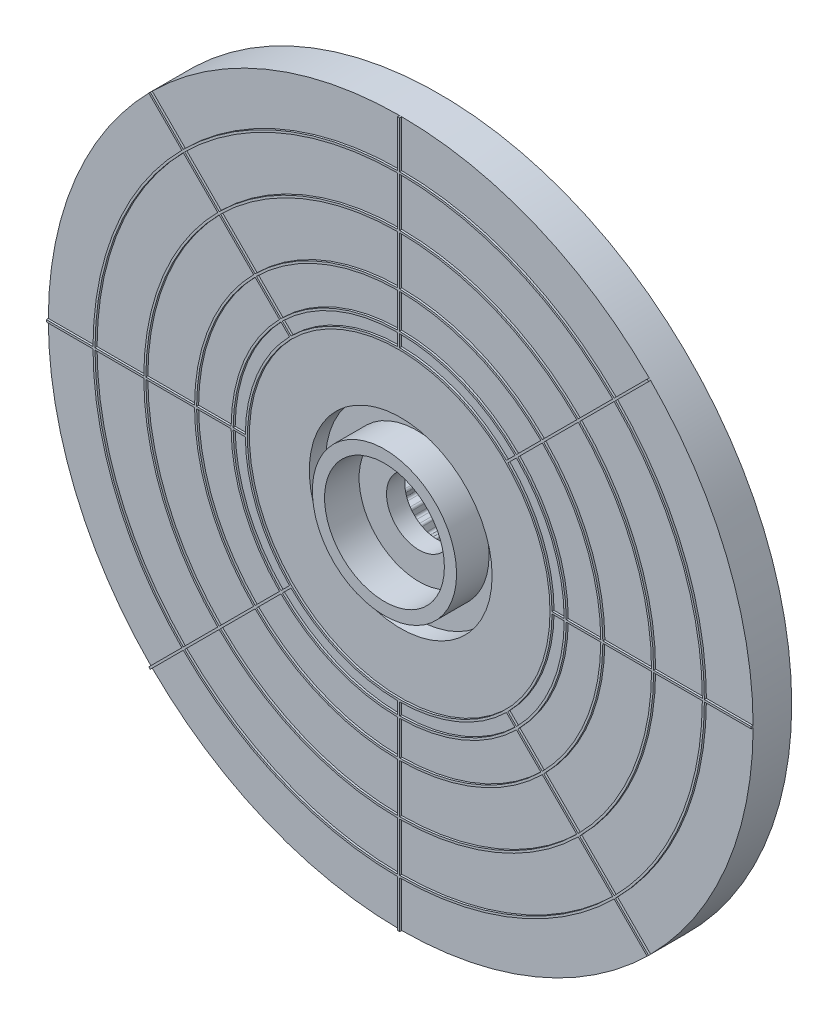
from build123d import *

# Parameters (mm, degrees)
AUFSATZ_LINEAR_START            = 3.1
AUFSATZ_LINEAR_AUSTRAGEN4_DEPTH = 3.1
KREISMUSTER1_COUNT              = 25
SKIZZE6_OUTSIDE_W               = 53.37
SKIZZE6_OUTSIDE_H               = 53.37
SKIZZE6_OUTSIDE_R               = 17.35
RUND1_DEPTH                     = 29.705574372
RUND2_OUTLINE_R                 = 7.45
RUND2_DEPTH                     = 0.1


# Read off the part's stored shape, not the designer's step: Rund2
with BuildPart() as part:
    # Skizze5 → Rotation2 (revolve)
    with BuildSketch(Plane(origin=(0, 0, 0), x_dir=(0, 0, -1), z_dir=(1, 0, 0)), mode=Mode.PRIVATE) as rotation2_sk:
        Polygon((0.75, 4.1), (3.1, 4.1), (3.1, 2.9), (0, 2.9), (0, 1.6), (-0.9, 1.6), (-0.9, 2.95), (-2.6, 2.95), (-2.6, 3.55), (-1, 3.55), (-1, 4.5), (-1.8, 4.5), (-1.8, 20), (0.1, 20), (0.1, 4.75), align=None)
    revolve(rotation2_sk.sketch.rotate(Axis((0, 0, 0), (0, 0, -1)), 90), axis=Axis((0, 0, 0), (0, 0, -1)))

    # Skizze4 → Aufsatz-Linear austragen4 (add)
    with BuildSketch(Plane.XY.offset(-3.1).offset(AUFSATZ_LINEAR_START)):
        with BuildLine():
            Line((-0.278608295, 2.846980046), (-0.072324759, 2.630941117))
            ThreePointArc((-0.072324759, 2.630941117), (0, 2.6), (0.072324759, 2.630941117))
            Line((0.072324759, 2.630941117), (0.278608295, 2.846980046))
            ThreePointArc((0.278608295, 2.846980046), (0.317450991, 2.872149352), (0.363466377, 2.877132634))
            ThreePointArc((0.363466377, 2.877132634), (0, 2.9), (-0.363466377, 2.877132634))
            ThreePointArc((-0.363466377, 2.877132634), (-0.317450991, 2.872149352), (-0.278608295, 2.846980046))
        make_face()
    aufsatz_linear_austragen4 = extrude(amount=-AUFSATZ_LINEAR_AUSTRAGEN4_DEPTH)

    # Kreismuster1: Aufsatz-Linear austragen4 ×25 about axis
    kreismuster1_axis = Axis((0, 0, 0), (0, 0, 1))
    for i in range(1, KREISMUSTER1_COUNT):
        add(aufsatz_linear_austragen4.rotate(kreismuster1_axis, i * 360 / KREISMUSTER1_COUNT))

    # Skizze6 outside → Rund1 (cut, through all)
    with BuildSketch(Plane.XY.offset(1.8)):
        Rectangle(SKIZZE6_OUTSIDE_W, SKIZZE6_OUTSIDE_H)
        Circle(SKIZZE6_OUTSIDE_R, mode=Mode.SUBTRACT)
    extrude(amount=-RUND1_DEPTH, mode=Mode.SUBTRACT)

    # Rund2 outline → Rund2 (add)
    with BuildSketch(Plane.XY.offset(1.8)):
        with BuildLine():
            Line((-0.05, 17.35), (-0.05, 15.049916943))
            ThreePointArc((-0.05, 15.049916943), (-5.759385657, 13.904386964), (-10.606542988, 10.677253666))
            Line((-10.606542988, 10.677253666), (-12.232947315, 12.303657993))
            Line((-12.232947315, 12.303657993), (-12.303657993, 12.232947315))
            Line((-12.303657993, 12.232947315), (-10.677253666, 10.606542988))
            ThreePointArc((-10.677253666, 10.606542988), (-13.904386964, 5.759385657), (-15.049916943, 0.05))
            Line((-15.049916943, 0.05), (-17.35, 0.05))
            Line((-17.35, 0.05), (-17.35, -0.05))
            Line((-17.35, -0.05), (-15.049916943, -0.05))
            ThreePointArc((-15.049916943, -0.05), (-13.904386964, -5.759385657), (-10.677253666, -10.606542988))
            Line((-10.677253666, -10.606542988), (-12.303657993, -12.232947315))
            Line((-12.303657993, -12.232947315), (-12.232947315, -12.303657993))
            Line((-12.232947315, -12.303657993), (-10.606542988, -10.677253666))
            ThreePointArc((-10.606542988, -10.677253666), (-5.759385657, -13.904386964), (-0.05, -15.049916943))
            Line((-0.05, -15.049916943), (-0.05, -17.35))
            Line((-0.05, -17.35), (0.05, -17.35))
            Line((0.05, -17.35), (0.05, -15.049916943))
            ThreePointArc((0.05, -15.049916943), (5.759385657, -13.904386964), (10.606542988, -10.677253666))
            Line((10.606542988, -10.677253666), (12.232947315, -12.303657993))
            Line((12.232947315, -12.303657993), (12.303657993, -12.232947315))
            Line((12.303657993, -12.232947315), (10.677253666, -10.606542988))
            ThreePointArc((10.677253666, -10.606542988), (13.904386964, -5.759385657), (15.049916943, -0.05))
            Line((15.049916943, -0.05), (17.35, -0.05))
            Line((17.35, -0.05), (17.35, 0.05))
            Line((17.35, 0.05), (15.049916943, 0.05))
            ThreePointArc((15.049916943, 0.05), (13.904386964, 5.759385657), (10.677253666, 10.606542988))
            Line((10.677253666, 10.606542988), (12.303657993, 12.232947315))
            Line((12.303657993, 12.232947315), (12.232947315, 12.303657993))
            Line((12.232947315, 12.303657993), (10.606542988, 10.677253666))
            ThreePointArc((10.606542988, 10.677253666), (5.759385657, 13.904386964), (0.05, 15.049916943))
            Line((0.05, 15.049916943), (0.05, 17.35))
            Line((0.05, 17.35), (-0.05, 17.35))
        make_face()
        with BuildLine():
            Line((-0.05, -12.549900398), (-0.05, -14.949916388))
            ThreePointArc((-0.05, -14.949916388), (-5.721117314, -13.811999011), (-10.535831917, -10.606542595))
            Line((-10.535831917, -10.606542595), (-8.838764336, -8.909475014))
            ThreePointArc((-8.838764336, -8.909475014), (-4.802677076, -11.594688133), (-0.05, -12.549900398))
        make_face(mode=Mode.SUBTRACT)
        with BuildLine():
            Line((-0.05, -10.049875621), (-0.05, -12.449899598))
            ThreePointArc((-0.05, -12.449899598), (-4.764408733, -11.50230018), (-8.768053092, -8.83876377))
            Line((-8.768053092, -8.83876377), (-7.070979863, -7.141690541))
            ThreePointArc((-7.070979863, -7.141690541), (-3.845968495, -9.284989302), (-0.05, -10.049875621))
        make_face(mode=Mode.SUBTRACT)
        with BuildLine():
            ThreePointArc((-12.549900398, -0.05), (-11.594688133, -4.802677076), (-8.909475014, -8.838764336))
            Line((-8.909475014, -8.838764336), (-10.606542595, -10.535831917))
            ThreePointArc((-10.606542595, -10.535831917), (-13.811999011, -5.721117314), (-14.949916388, -0.05))
            Line((-14.949916388, -0.05), (-12.549900398, -0.05))
        make_face(mode=Mode.SUBTRACT)
        with BuildLine():
            ThreePointArc((-10.049875621, -0.05), (-9.284989302, -3.845968495), (-7.141690541, -7.070979863))
            Line((-7.141690541, -7.070979863), (-8.83876377, -8.768053092))
            ThreePointArc((-8.83876377, -8.768053092), (-11.50230018, -4.764408733), (-12.449899598, -0.05))
            Line((-12.449899598, -0.05), (-10.049875621, -0.05))
        make_face(mode=Mode.SUBTRACT)
        with BuildLine():
            Line((-0.05, -8.249848483), (-0.05, -9.949874371))
            ThreePointArc((-0.05, -9.949874371), (-3.807700152, -9.192601348), (-7.000268301, -7.070978979))
            Line((-7.000268301, -7.070978979), (-5.798168467, -5.868879145))
            ThreePointArc((-5.798168467, -5.868879145), (-3.157138317, -7.622006143), (-0.05, -8.249848483))
        make_face(mode=Mode.SUBTRACT)
        with BuildLine():
            Line((-0.05, -7.549834435), (-0.05, -8.149846624))
            ThreePointArc((-0.05, -8.149846624), (-3.118869974, -7.52961819), (-5.727456475, -5.798167153))
            Line((-5.727456475, -5.798167153), (-5.303183787, -5.373894465))
            ThreePointArc((-5.303183787, -5.373894465), (-2.889259914, -6.97529047), (-0.05, -7.549834435))
        make_face(mode=Mode.SUBTRACT)
        with BuildLine():
            Line((-5.868879145, -5.798168467), (-7.070978979, -7.000268301))
            ThreePointArc((-7.070978979, -7.000268301), (-9.192601348, -3.807700152), (-9.949874371, -0.05))
            Line((-9.949874371, -0.05), (-8.249848483, -0.05))
            ThreePointArc((-8.249848483, -0.05), (-7.622006143, -3.157138317), (-5.868879145, -5.798168467))
        make_face(mode=Mode.SUBTRACT)
        with BuildLine():
            Line((-5.373894465, -5.303183787), (-5.798167153, -5.727456475))
            ThreePointArc((-5.798167153, -5.727456475), (-7.52961819, -3.118869974), (-8.149846624, -0.05))
            Line((-8.149846624, -0.05), (-7.549834435, -0.05))
            ThreePointArc((-7.549834435, -0.05), (-6.97529047, -2.889259914), (-5.373894465, -5.303183787))
        make_face(mode=Mode.SUBTRACT)
        with BuildLine():
            ThreePointArc((10.535831917, -10.606542595), (5.721117314, -13.811999011), (0.05, -14.949916388))
            Line((0.05, -14.949916388), (0.05, -12.549900398))
            ThreePointArc((0.05, -12.549900398), (4.802677076, -11.594688133), (8.838764336, -8.909475014))
            Line((8.838764336, -8.909475014), (10.535831917, -10.606542595))
        make_face(mode=Mode.SUBTRACT)
        with BuildLine():
            ThreePointArc((8.768053092, -8.83876377), (4.764408733, -11.50230018), (0.05, -12.449899598))
            Line((0.05, -12.449899598), (0.05, -10.049875621))
            ThreePointArc((0.05, -10.049875621), (3.845968495, -9.284989302), (7.070979863, -7.141690541))
            Line((7.070979863, -7.141690541), (8.768053092, -8.83876377))
        make_face(mode=Mode.SUBTRACT)
        with BuildLine():
            ThreePointArc((7.000268301, -7.070978979), (3.807700152, -9.192601348), (0.05, -9.949874371))
            Line((0.05, -9.949874371), (0.05, -8.249848483))
            ThreePointArc((0.05, -8.249848483), (3.157138317, -7.622006143), (5.798168467, -5.868879145))
            Line((5.798168467, -5.868879145), (7.000268301, -7.070978979))
        make_face(mode=Mode.SUBTRACT)
        with BuildLine():
            ThreePointArc((5.727456475, -5.798167153), (3.118869974, -7.52961819), (0.05, -8.149846624))
            Line((0.05, -8.149846624), (0.05, -7.549834435))
            ThreePointArc((0.05, -7.549834435), (2.889259914, -6.97529047), (5.303183787, -5.373894465))
            Line((5.303183787, -5.373894465), (5.727456475, -5.798167153))
        make_face(mode=Mode.SUBTRACT)
        with BuildLine():
            Line((8.249848483, -0.05), (9.949874371, -0.05))
            ThreePointArc((9.949874371, -0.05), (9.192601348, -3.807700152), (7.070978979, -7.000268301))
            Line((7.070978979, -7.000268301), (5.868879145, -5.798168467))
            ThreePointArc((5.868879145, -5.798168467), (7.622006143, -3.157138317), (8.249848483, -0.05))
        make_face(mode=Mode.SUBTRACT)
        with BuildLine():
            ThreePointArc((8.149846624, -0.05), (7.52961819, -3.118869974), (5.798167153, -5.727456475))
            Line((5.798167153, -5.727456475), (5.373894465, -5.303183787))
            ThreePointArc((5.373894465, -5.303183787), (6.97529047, -2.889259914), (7.549834435, -0.05))
            Line((7.549834435, -0.05), (8.149846624, -0.05))
        make_face(mode=Mode.SUBTRACT)
        with BuildLine():
            ThreePointArc((7.141690541, -7.070979863), (9.284989302, -3.845968495), (10.049875621, -0.05))
            Line((10.049875621, -0.05), (12.449899598, -0.05))
            ThreePointArc((12.449899598, -0.05), (11.50230018, -4.764408733), (8.83876377, -8.768053092))
            Line((8.83876377, -8.768053092), (7.141690541, -7.070979863))
        make_face(mode=Mode.SUBTRACT)
        with BuildLine():
            ThreePointArc((8.909475014, -8.838764336), (11.594688133, -4.802677076), (12.549900398, -0.05))
            Line((12.549900398, -0.05), (14.949916388, -0.05))
            ThreePointArc((14.949916388, -0.05), (13.811999011, -5.721117314), (10.606542595, -10.535831917))
            Line((10.606542595, -10.535831917), (8.909475014, -8.838764336))
        make_face(mode=Mode.SUBTRACT)
        with BuildLine():
            ThreePointArc((-8.909475014, 8.838764336), (-11.594688133, 4.802677076), (-12.549900398, 0.05))
            Line((-12.549900398, 0.05), (-14.949916388, 0.05))
            ThreePointArc((-14.949916388, 0.05), (-13.811999011, 5.721117314), (-10.606542595, 10.535831917))
            Line((-10.606542595, 10.535831917), (-8.909475014, 8.838764336))
        make_face(mode=Mode.SUBTRACT)
        with BuildLine():
            ThreePointArc((-7.141690541, 7.070979863), (-9.284989302, 3.845968495), (-10.049875621, 0.05))
            Line((-10.049875621, 0.05), (-12.449899598, 0.05))
            ThreePointArc((-12.449899598, 0.05), (-11.50230018, 4.764408733), (-8.83876377, 8.768053092))
            Line((-8.83876377, 8.768053092), (-7.141690541, 7.070979863))
        make_face(mode=Mode.SUBTRACT)
        with BuildLine():
            ThreePointArc((-8.149846624, 0.05), (-7.52961819, 3.118869974), (-5.798167153, 5.727456475))
            Line((-5.798167153, 5.727456475), (-5.373894465, 5.303183787))
            ThreePointArc((-5.373894465, 5.303183787), (-6.97529047, 2.889259914), (-7.549834435, 0.05))
            Line((-7.549834435, 0.05), (-8.149846624, 0.05))
        make_face(mode=Mode.SUBTRACT)
        with BuildLine():
            ThreePointArc((-9.949874371, 0.05), (-9.192601348, 3.807700152), (-7.070978979, 7.000268301))
            Line((-7.070978979, 7.000268301), (-5.868879145, 5.798168467))
            ThreePointArc((-5.868879145, 5.798168467), (-7.622006143, 3.157138317), (-8.249848483, 0.05))
            Line((-8.249848483, 0.05), (-9.949874371, 0.05))
        make_face(mode=Mode.SUBTRACT)
        with BuildLine():
            Line((-0.05, 8.149846624), (-0.05, 7.549834435))
            ThreePointArc((-0.05, 7.549834435), (-2.889259914, 6.97529047), (-5.303183787, 5.373894465))
            Line((-5.303183787, 5.373894465), (-5.727456475, 5.798167153))
            ThreePointArc((-5.727456475, 5.798167153), (-3.118869974, 7.52961819), (-0.05, 8.149846624))
        make_face(mode=Mode.SUBTRACT)
        with BuildLine():
            Line((-0.05, 9.949874371), (-0.05, 8.249848483))
            ThreePointArc((-0.05, 8.249848483), (-3.157138317, 7.622006143), (-5.798168467, 5.868879145))
            Line((-5.798168467, 5.868879145), (-7.000268301, 7.070978979))
            ThreePointArc((-7.000268301, 7.070978979), (-3.807700152, 9.192601348), (-0.05, 9.949874371))
        make_face(mode=Mode.SUBTRACT)
        with BuildLine():
            Line((-0.05, 12.449899598), (-0.05, 10.049875621))
            ThreePointArc((-0.05, 10.049875621), (-3.845968495, 9.284989302), (-7.070979863, 7.141690541))
            Line((-7.070979863, 7.141690541), (-8.768053092, 8.83876377))
            ThreePointArc((-8.768053092, 8.83876377), (-4.764408733, 11.50230018), (-0.05, 12.449899598))
        make_face(mode=Mode.SUBTRACT)
        with BuildLine():
            Line((-0.05, 14.949916388), (-0.05, 12.549900398))
            ThreePointArc((-0.05, 12.549900398), (-4.802677076, 11.594688133), (-8.838764336, 8.909475014))
            Line((-8.838764336, 8.909475014), (-10.535831917, 10.606542595))
            ThreePointArc((-10.535831917, 10.606542595), (-5.721117314, 13.811999011), (-0.05, 14.949916388))
        make_face(mode=Mode.SUBTRACT)
        Circle(RUND2_OUTLINE_R, mode=Mode.SUBTRACT)
        with BuildLine():
            Line((5.373894465, 5.303183787), (5.798167153, 5.727456475))
            ThreePointArc((5.798167153, 5.727456475), (7.52961819, 3.118869974), (8.149846624, 0.05))
            Line((8.149846624, 0.05), (7.549834435, 0.05))
            ThreePointArc((7.549834435, 0.05), (6.97529047, 2.889259914), (5.373894465, 5.303183787))
        make_face(mode=Mode.SUBTRACT)
        with BuildLine():
            Line((5.868879145, 5.798168467), (7.070978979, 7.000268301))
            ThreePointArc((7.070978979, 7.000268301), (9.192601348, 3.807700152), (9.949874371, 0.05))
            Line((9.949874371, 0.05), (8.249848483, 0.05))
            ThreePointArc((8.249848483, 0.05), (7.622006143, 3.157138317), (5.868879145, 5.798168467))
        make_face(mode=Mode.SUBTRACT)
        with BuildLine():
            ThreePointArc((5.303183787, 5.373894465), (2.889259914, 6.97529047), (0.05, 7.549834435))
            Line((0.05, 7.549834435), (0.05, 8.149846624))
            ThreePointArc((0.05, 8.149846624), (3.118869974, 7.52961819), (5.727456475, 5.798167153))
            Line((5.727456475, 5.798167153), (5.303183787, 5.373894465))
        make_face(mode=Mode.SUBTRACT)
        with BuildLine():
            ThreePointArc((5.798168467, 5.868879145), (3.157138317, 7.622006143), (0.05, 8.249848483))
            Line((0.05, 8.249848483), (0.05, 9.949874371))
            ThreePointArc((0.05, 9.949874371), (3.807700152, 9.192601348), (7.000268301, 7.070978979))
            Line((7.000268301, 7.070978979), (5.798168467, 5.868879145))
        make_face(mode=Mode.SUBTRACT)
        with BuildLine():
            ThreePointArc((10.049875621, 0.05), (9.284989302, 3.845968495), (7.141690541, 7.070979863))
            Line((7.141690541, 7.070979863), (8.83876377, 8.768053092))
            ThreePointArc((8.83876377, 8.768053092), (11.50230018, 4.764408733), (12.449899598, 0.05))
            Line((12.449899598, 0.05), (10.049875621, 0.05))
        make_face(mode=Mode.SUBTRACT)
        with BuildLine():
            ThreePointArc((12.549900398, 0.05), (11.594688133, 4.802677076), (8.909475014, 8.838764336))
            Line((8.909475014, 8.838764336), (10.606542595, 10.535831917))
            ThreePointArc((10.606542595, 10.535831917), (13.811999011, 5.721117314), (14.949916388, 0.05))
            Line((14.949916388, 0.05), (12.549900398, 0.05))
        make_face(mode=Mode.SUBTRACT)
        with BuildLine():
            ThreePointArc((7.070979863, 7.141690541), (3.845968495, 9.284989302), (0.05, 10.049875621))
            Line((0.05, 10.049875621), (0.05, 12.449899598))
            ThreePointArc((0.05, 12.449899598), (4.764408733, 11.50230018), (8.768053092, 8.83876377))
            Line((8.768053092, 8.83876377), (7.070979863, 7.141690541))
        make_face(mode=Mode.SUBTRACT)
        with BuildLine():
            ThreePointArc((8.838764336, 8.909475014), (4.802677076, 11.594688133), (0.05, 12.549900398))
            Line((0.05, 12.549900398), (0.05, 14.949916388))
            ThreePointArc((0.05, 14.949916388), (5.721117314, 13.811999011), (10.535831917, 10.606542595))
            Line((10.535831917, 10.606542595), (8.838764336, 8.909475014))
        make_face(mode=Mode.SUBTRACT)
    extrude(amount=RUND2_DEPTH)


solid = part.part
